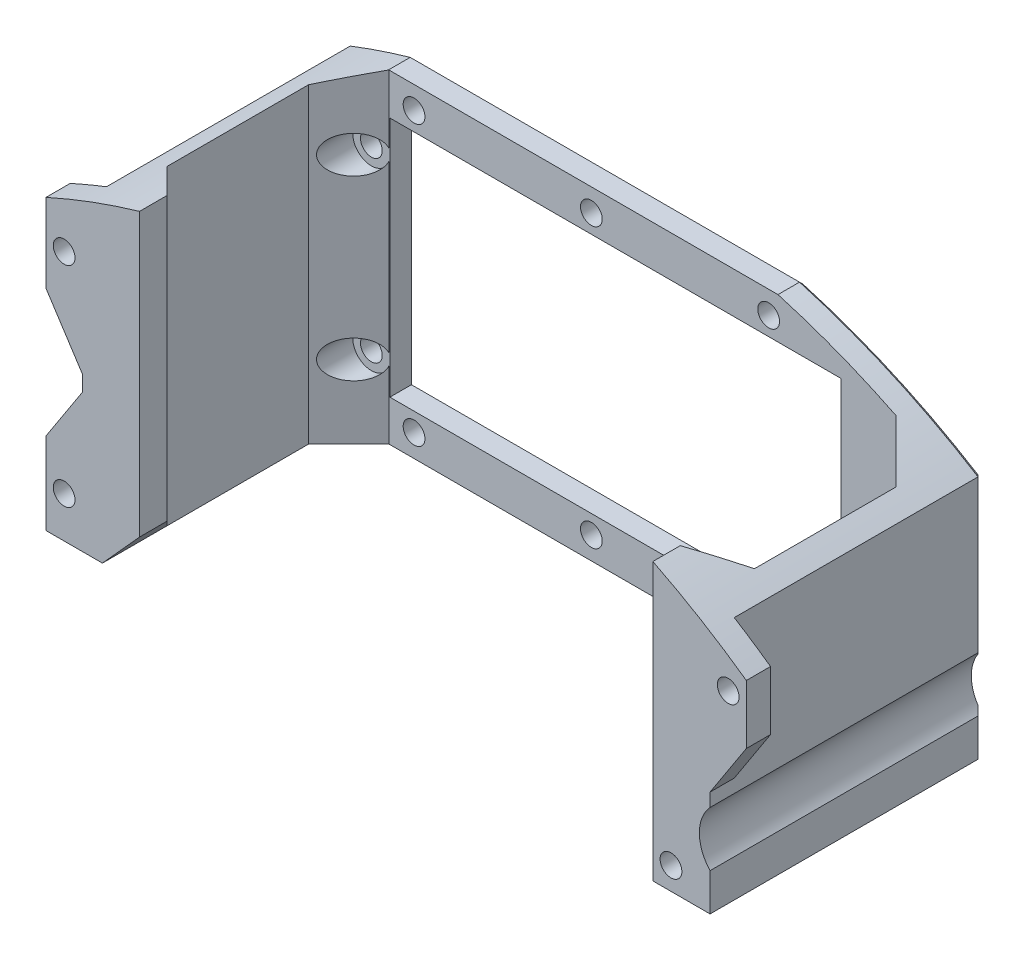
from build123d import *

# Parameters (mm, degrees)
SKETCH1_R           = 1.35
SKETCH1_W           = 56
SKETCH1_H           = 30
BOSS_EXTRUDE1_DEPTH = 3.175
SKETCH2_W           = 2.5
SKETCH2_H           = 40.2
SKETCH2_H_2         = 35.1
BOSS_EXTRUDE2_DEPTH = 27.57
SKETCH3_R           = 1.35
BOSS_EXTRUDE3_DEPTH = 3
CHAMFER1_SIZE       = 0.5
CHAMFER3_SIZE       = 5
SKETCH5_R           = 2.3
CUT_EXTRUDE2_DEPTH  = 7
CHAMFER4_SIZE       = 0.5
CUT_EXTRUDE3_DEPTH  = 33.745
CHAMFER5_SIZE       = 0.5
CHAMFER6_SIZE       = 5
CHAMFER7_SIZE       = 4.545853152
CHAMFER7_SIZE_2     = 7
SKETCH7_R           = 5
CUT_EXTRUDE4_DEPTH  = 64.425350019
CHAMFER8_SIZE       = 7
CHAMFER8_SIZE_2     = 4.545853152
SKETCH9_R           = 2.35
CUT_EXTRUDE5_DEPTH  = 30.745


# Read off the part's stored shape, not the designer's step: Cut-Extrude3
with BuildPart() as part:
    # Sketch1 → Boss-Extrude1 (new body)
    with BuildSketch(Plane.XY):
        Polygon((33.5, 20.1), (45.3, 15), (45.3, -20.1), (-32.6, -20.1), (-32.6, 20.1), align=None)
        with Locations((22, 17.3)):
            Circle(SKETCH1_R, mode=Mode.SUBTRACT)
        with Locations((0, 17.3)):
            Circle(SKETCH1_R, mode=Mode.SUBTRACT)
        with Locations((-22, 17.3)):
            Circle(SKETCH1_R, mode=Mode.SUBTRACT)
        with Locations((-27.3, 11)):
            Circle(SKETCH1_R, mode=Mode.SUBTRACT)
        with Locations(Location((22, -17.3, 0), (0, 0, 180))):
            Circle(SKETCH1_R, mode=Mode.SUBTRACT)
        with Locations(Location((0, -17.3, 0), (0, 0, 180))):
            Circle(SKETCH1_R, mode=Mode.SUBTRACT)
        with Locations(Location((-22, -17.3, 0), (0, 0, 180))):
            Circle(SKETCH1_R, mode=Mode.SUBTRACT)
        with Locations(Location((-27.3, -11, 0), (0, 0, 180))):
            Circle(SKETCH1_R, mode=Mode.SUBTRACT)
        with Locations((3, 0)):
            Rectangle(SKETCH1_W, SKETCH1_H, mode=Mode.SUBTRACT)
    extrude(amount=BOSS_EXTRUDE1_DEPTH)

    # Sketch2 → Boss-Extrude2 (add)
    with BuildSketch(Plane.XY.offset(3.175)):
        with Locations((-31.35, 0)):
            Rectangle(SKETCH2_W, SKETCH2_H)
        with Locations((44.05, -2.55)):
            Rectangle(SKETCH2_W, SKETCH2_H_2)
    extrude(amount=BOSS_EXTRUDE2_DEPTH)

    # Sketch3 → Boss-Extrude3 (add)
    # profile 1 of 2: a face of its own
    with BuildSketch(Plane.XY.offset(30.745)):
        Polygon((49.8, 0), (45.3, 0), (45.3, -20.1), (38.2, -20.1), (38.2, 15), (49.8, 15), align=None)
        with Locations((47.55, 5)):
            Circle(SKETCH3_R, mode=Mode.SUBTRACT)
        with Locations((40.45, -17.3)):
            Circle(SKETCH3_R, mode=Mode.SUBTRACT)
    # profile 2 of 2: a face of its own
    with BuildSketch(Plane.XY.offset(30.745)):
        Polygon((-25.5, 20.1), (-37.1, 20.1), (-37.1, 6), (-32.6, 6), (-32.6, -10), (-37.1, -10), (-37.1, -20.1), (-30.1, -20.1), (-25.5, -15), align=None)
        with Locations((-34.85, 11)):
            Circle(SKETCH3_R, mode=Mode.SUBTRACT)
        with Locations((-34.85, -15)):
            Circle(SKETCH3_R, mode=Mode.SUBTRACT)
    extrude(amount=BOSS_EXTRUDE3_DEPTH)

    # Chamfer1
    chamfer1_edges = [part.edges().sort_by_distance(p)[0] for p in [
        (3, -15, 0),
        (31, 0, 0),
        (3, 15, 0),
        (-25, 0, 0),
    ]]
    chamfer(chamfer1_edges, length=CHAMFER1_SIZE)

    # Chamfer3
    # the kernel refuses this chamfer: 5 mm, written as the material it adds along each edge
    with BuildSketch(Plane(origin=(-30.1, 20.1, 3.175), x_dir=(0.9996219169112968, 0, -0.027495876610586386), z_dir=(0, -1, 0))) as chamfer3_piece_1_section:
        Polygon((CHAMFER3_SIZE * 0.999621916911, CHAMFER3_SIZE * 0.0274958766106), (-CHAMFER3_SIZE * 0.0274958766106, CHAMFER3_SIZE * 0.999621916911), (0, 0), align=None)
    chamfer3_piece_1 = extrude(amount=40.2, mode=Mode.PRIVATE)
    chamfer3_piece_1 = chamfer3_piece_1 - Plane(origin=(-27.3, -11, 4.84942863), x_dir=(-1, 0, 0), z_dir=(0, 0, -1)) * Cylinder(1.35, 101, mode=Mode.PRIVATE)
    chamfer3_piece_1 = chamfer3_piece_1 - Plane(origin=(-27.3, 11, 4.84942863), x_dir=(1, 0, 0), z_dir=(0, 0, -1)) * Cylinder(1.35, 101, mode=Mode.PRIVATE)
    add(chamfer3_piece_1)
    with BuildSketch(Plane(origin=(42.8, 15, 3.175), x_dir=(-0.9996219169112968, 0, -0.027495876610586403), z_dir=(0, -1, 0))) as chamfer3_piece_2:
        Polygon((CHAMFER3_SIZE * 0.999621916911, -CHAMFER3_SIZE * 0.0274958766106), (-CHAMFER3_SIZE * 0.0274958766106, -CHAMFER3_SIZE * 0.999621916911), (0, 0), align=None)
    extrude(amount=35.1)

    # Sketch5 → Cut-Extrude2 (cut)
    with BuildSketch(Plane.XY.offset(3.175)):
        with Locations((-27.3, 11)):
            Circle(SKETCH5_R)
        with Locations((-27.3, -11)):
            Circle(SKETCH5_R)
    extrude(amount=CUT_EXTRUDE2_DEPTH, mode=Mode.SUBTRACT)

    # Chamfer4
    chamfer4_edges = [part.edges().sort_by_distance(p)[0] for p in [
        (41.55, 15, 3.175),
    ]]
    chamfer(chamfer4_edges, length=CHAMFER4_SIZE)

    # Cut-Extrude3 outline → Cut-Extrude3 (cut)
    with BuildSketch(Plane.XY):
        with BuildLine():
            Line((33.5, 20.1), (23.154502686, 20.1))
            ThreePointArc((23.154502686, 20.1), (37.024570378, 14.805977232), (49.8, 7.243315476))
            Line((49.8, 7.243315476), (49.8, 15))
            Line((49.8, 15), (45.3, 15))
            Line((45.3, 15), (33.5, 20.1))
        make_face()
        with BuildLine():
            ThreePointArc((-37.1, 15.705959627), (-31.207253619, 18.120471436), (-25.154502686, 20.1))
            Line((-25.154502686, 20.1), (-37.1, 20.1))
            Line((-37.1, 20.1), (-37.1, 15.705959627))
        make_face()
    extrude(amount=CUT_EXTRUDE3_DEPTH, mode=Mode.SUBTRACT)

    # Chamfer5
    chamfer5_edges = [part.edges().sort_by_distance(p)[0] for p in [
        (-1, 20.1, 0),
        (-32.6, -1.252665528, 0),
        (34.570093208, 15.943845724, 0),
        (-28.905381441, 18.930933232, 0),
        (45.3, -4.926691958, 0),
    ]]
    chamfer(chamfer5_edges, length=CHAMFER5_SIZE)

    # Chamfer6
    # the kernel refuses this chamfer: 5 mm, written as the material it adds along each edge
    with BuildSketch(Plane(origin=(-30.1, 31.377746009, 30.745), x_dir=(-0.027495876610586317, 0, -0.9996219169112968), z_dir=(0, -1, 0))) as chamfer6_piece_1_section:
        Polygon((CHAMFER6_SIZE * 0.999621916911, CHAMFER6_SIZE * 0.0274958766106), (-CHAMFER6_SIZE * 0.0274958766106, CHAMFER6_SIZE * 0.999621916911), (0, 0), align=None)
    chamfer6_piece_1 = extrude(amount=51.477746009, mode=Mode.PRIVATE)
    chamfer6_piece_1 = split(chamfer6_piece_1, bisect_by=Plane(origin=(-19.223588123, -8.041369441, 29.056632275), z_dir=(-0.7425697235686511, 0.6697687702776064, 0)), keep=Keep.TOP, mode=Mode.PRIVATE)
    chamfer6_piece_1 = chamfer6_piece_1 & Plane(origin=(-1.000000031, -63.999999922, 29.056632275), x_dir=(-0.4125714286119157, 0.9109252528572929, 0), z_dir=(0, 0, -1)) * Cylinder(87.499999916, 123, mode=Mode.PRIVATE)
    chamfer6_piece_1 = split(chamfer6_piece_1, bisect_by=Plane(origin=(-25.5, 0.348686726, 29.056632275), z_dir=(-1, 0, 0)), keep=Keep.TOP, mode=Mode.PRIVATE)
    add(chamfer6_piece_1)
    with BuildSketch(Plane(origin=(42.8, 24.606748254, 30.745), x_dir=(-0.9996219169112968, 0, 0.027495876610586317), z_dir=(0, -1, 0))) as chamfer6_piece_2_section:
        Polygon((CHAMFER6_SIZE * 0.999621916911, CHAMFER6_SIZE * 0.0274958766106), (-CHAMFER6_SIZE * 0.0274958766106, CHAMFER6_SIZE * 0.999621916911), (0, 0), align=None)
    chamfer6_piece_2 = extrude(amount=44.706748254, mode=Mode.PRIVATE)
    chamfer6_piece_2 = split(chamfer6_piece_2, bisect_by=Plane(origin=(38.2, -3.223741297, 29.074949458), z_dir=(1, 0, 0)), keep=Keep.TOP, mode=Mode.PRIVATE)
    chamfer6_piece_2 = chamfer6_piece_2 & Plane(origin=(-1.000000015, -64.000000032, 29.074949458), x_dir=(0.2760514593327394, 0.9611428571238851, 0), z_dir=(0, 0, -1)) * Cylinder(87.500000035, 110, mode=Mode.PRIVATE)
    chamfer6_piece_2 = chamfer6_piece_2 - Plane(origin=(40.45, -17.3, 29.074949458), x_dir=(1, 0, 0), z_dir=(0, 0, -1)) * Cylinder(1.35, 110, mode=Mode.PRIVATE)
    add(chamfer6_piece_2)

    # Chamfer7
    # the kernel refuses this chamfer: 7, 4.545853152 mm, written as the material it adds along each edge
    with BuildSketch(Plane(origin=(45.3, 0, 30.745), x_dir=(0.9987532912567346, 0.049918565722988334, 0), z_dir=(0, 0, 1))) as chamfer7_piece_1_section:
        Polygon((CHAMFER7_SIZE * 0.998753291341, -CHAMFER7_SIZE * 0.0499185657272), (-CHAMFER7_SIZE_2 * 0.049918565723, -CHAMFER7_SIZE_2 * 0.998753291257), (0, 0), align=None)
    chamfer7_piece_1 = extrude(amount=3, mode=Mode.PRIVATE)
    chamfer7_piece_1 = split(chamfer7_piece_1, bisect_by=Plane(origin=(49.8, -2.345805882, 32.245), z_dir=(-1, 0, 0)), keep=Keep.TOP, mode=Mode.PRIVATE)
    add(chamfer7_piece_1)

    # Sketch7 → Cut-Extrude4 (cut, through all)
    with BuildSketch(Plane(origin=(0, 0, 0), x_dir=(-1, 0, 0), z_dir=(0, 0, -1))):
        with Locations((-48.97, -12.05)):
            Circle(SKETCH7_R)
    extrude(amount=-CUT_EXTRUDE4_DEPTH, mode=Mode.SUBTRACT)

    # Chamfer8
    # the kernel refuses this chamfer: 7, 4.545853152 mm, written as the material it adds along each edge
    with BuildSketch(Plane(origin=(-32.6, -10, 30.745), x_dir=(0.02107376546627368, 0.9997779235455605, 0), z_dir=(0, 0, 1))) as chamfer8_piece_1_section:
        Polygon((CHAMFER8_SIZE * 0.999777923546, CHAMFER8_SIZE * 0.0210737654663), (-CHAMFER8_SIZE_2 * 0.021073765468, CHAMFER8_SIZE_2 * 0.99977792363), (0, 0), align=None)
    chamfer8_piece_1 = extrude(amount=3, mode=Mode.PRIVATE)
    chamfer8_piece_1 = split(chamfer8_piece_1, bisect_by=Plane(origin=(-37.1, -7.654194118, 32.245), z_dir=(1, 0, 0)), keep=Keep.TOP, mode=Mode.PRIVATE)
    add(chamfer8_piece_1)
    with BuildSketch(Plane(origin=(-32.6, 6, 30.745), x_dir=(-0.9987532912567346, 0.049918565722988396, 0), z_dir=(0, 0, 1))) as chamfer8_piece_2_section:
        Polygon((CHAMFER8_SIZE_2 * 0.998753291341, CHAMFER8_SIZE_2 * 0.0499185657272), (-CHAMFER8_SIZE * 0.049918565723, CHAMFER8_SIZE * 0.998753291257), (0, 0), align=None)
    chamfer8_piece_2 = extrude(amount=3, mode=Mode.PRIVATE)
    chamfer8_piece_2 = split(chamfer8_piece_2, bisect_by=Plane(origin=(-37.1, 3.654194118, 32.245), z_dir=(1, 0, 0)), keep=Keep.TOP, mode=Mode.PRIVATE)
    add(chamfer8_piece_2)

    # Sketch9 → Cut-Extrude5 (cut)
    with BuildSketch(Plane.XY):
        with Locations((40.45, -17.3)):
            Circle(SKETCH9_R)
    extrude(amount=CUT_EXTRUDE5_DEPTH, mode=Mode.SUBTRACT)


solid = part.part
